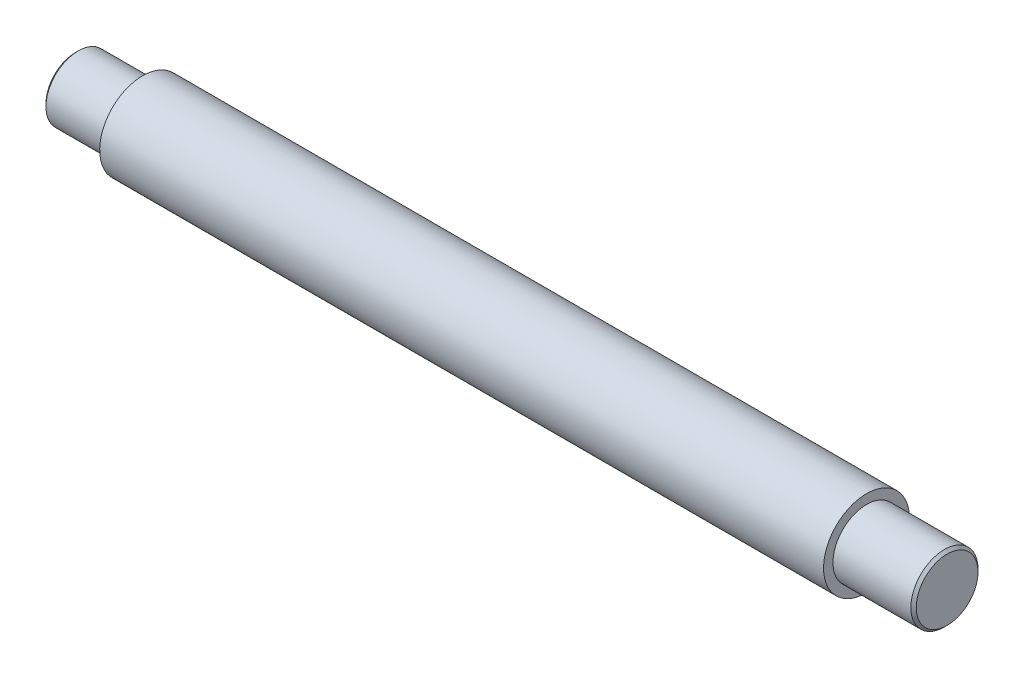
from build123d import *

# Parameters (mm, degrees)
ENL_V_MAT_EXTRU_1_DEPTH = 10
ENL_V_MAT_EXTRU_2_DEPTH = 48
CHANFREIN1_SIZE         = 1


with BuildPart() as part:
    # Esquisse2 → Révolution1 (revolve)
    with BuildSketch(Plane(origin=(0, 370.999683861, -115.203114608), x_dir=(1, 0, 0), z_dir=(-1.0908795532301448e-15, -0.9550165539463022, 0.29655249398467304))):
        Polygon((311.461782962, 222.210416358), (311.461782962, 210.710416358), (-13, 210.710416358), (-13, 222.710416358), (12, 222.710416358), (12, 226.710416358), (281.461782962, 226.710416358), (281.461782962, 223.210416358), (310.461782962, 223.210416358), align=None)
    revolve(axis=Axis((-27.883598113, 433.48638334, 86.028821103), (1, 0, 0)))

    # Esquisse3 → Enlèv. mat.-Extru.1 (cut)
    with BuildSketch(Plane(origin=(0, 421.48638334, 0), x_dir=(-1, 0, 0), z_dir=(0, 1, 0))):
        with BuildLine():
            Line((-207.961782962, 90.028821103), (-195.961782962, 90.028821103))
            ThreePointArc((-195.961782962, 90.028821103), (-191.961782962, 86.028821103), (-195.961782962, 82.028821103))
            Line((-195.961782962, 82.028821103), (-207.961782962, 82.028821103))
            ThreePointArc((-207.961782962, 82.028821103), (-211.961782962, 86.028821103), (-207.961782962, 90.028821103))
        make_face()
        with BuildLine():
            Line((-51.961782962, 90.028821103), (-39.961782962, 90.028821103))
            ThreePointArc((-39.961782962, 90.028821103), (-35.961782962, 86.028821103), (-39.961782962, 82.028821103))
            Line((-39.961782962, 82.028821103), (-51.961782962, 82.028821103))
            ThreePointArc((-51.961782962, 82.028821103), (-55.961782962, 86.028821103), (-51.961782962, 90.028821103))
        make_face()
    extrude(amount=-ENL_V_MAT_EXTRU_1_DEPTH, mode=Mode.SUBTRACT)

    # Esquisse4 → Enlèv. mat.-Extru.2 (cut)
    with BuildSketch(Plane(origin=(0, 55.966827365, -112.25208965), x_dir=(-1, 0, 0), z_dir=(-1.1054907012305635e-15, -0.4461978131098129, 0.8949343616020231))):
        with BuildLine():
            Line((-305.461782962, -423.327731578), (-287.461782962, -423.327731578))
            ThreePointArc((-287.461782962, -423.327731578), (-284.461782962, -426.327731578), (-287.461782962, -429.327731578))
            Line((-287.461782962, -429.327731578), (-305.461782962, -429.327731578))
            ThreePointArc((-305.461782962, -429.327731578), (-308.461782962, -426.327731578), (-305.461782962, -423.327731578))
        make_face()
    extrude(amount=-ENL_V_MAT_EXTRU_2_DEPTH, mode=Mode.SUBTRACT)

    # Chanfrein1
    chanfrein1_edges = [part.edges().sort_by_distance(p)[0] for p in [
        (-13, 429.927753412, 74.568622456),
    ]]
    chamfer(chanfrein1_edges, length=CHANFREIN1_SIZE)


solid = part.part
